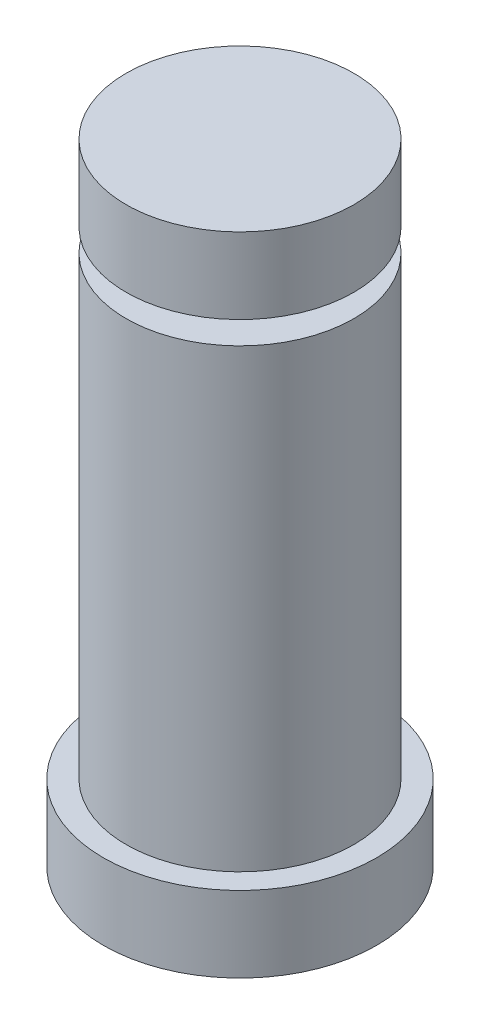
from build123d import *

# Parameters (mm, degrees)
SKETCH2_W = 2.65
SKETCH2_H = 1.5


with BuildPart() as part:
    # Sketch1 → Revolve1 (revolve)
    with BuildSketch(Plane.XY):
        Polygon((0, 0), (9, 0), (9, 5), (7.5, 5), (7.5, 41.5), (0, 41.5), align=None)
    revolve(axis=Axis((0, 46.5, 0), (0, -1, 0)))

    # Sketch2 → Cut-Revolve1 (revolve, cut)
    with BuildSketch(Plane.XY):
        with Locations((6.175, 35.75)):
            Rectangle(SKETCH2_W, SKETCH2_H)
    revolve(axis=Axis((0, 41.5, 0), (0, -1, 0)), mode=Mode.SUBTRACT)


solid = part.part
